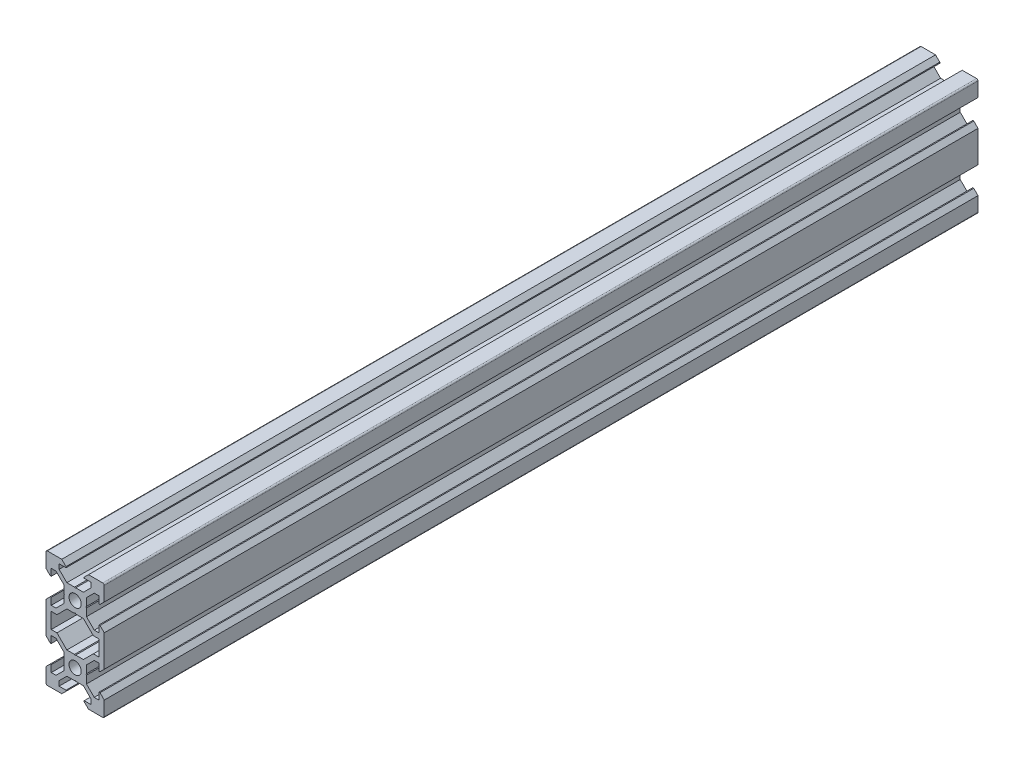
from build123d import *

# Parameters (mm, degrees)
BOSS_EXTRU_1_DEPTH  = 300
SYM_TRIE6_OUTLINE_R = 2.1
SYM_TRIE6_DEPTH     = 300


# Read off the part's stored shape, not the designer's step: Symétrie6
with BuildPart() as part:
    # Esquisse1 → Boss.-Extru.1 (new body)
    with BuildSketch(Plane.XY):
        with BuildLine():
            Line((-9.5, 10), (-4.58, 10))
            Line((-4.58, 10), (-3.125, 8.545))
            Line((-3.125, 8.545), (-3.125, 8.2))
            Line((-3.125, 8.2), (-5.5, 8.2))
            Line((-5.5, 8.2), (-5.5, 6.560660172))
            Line((-5.5, 6.560660172), (-2.839339828, 3.9))
            Line((-2.839339828, 3.9), (-0.21, 3.9))
            Line((-0.21, 3.9), (0, 3.69))
            Line((0, 3.69), (0, 2.1))
            ThreePointArc((0, 2.1), (-2.1, 0), (0, -2.1))
            Line((0, -2.1), (0, -3.69))
            Line((0, -3.69), (-0.21, -3.9))
            Line((-0.21, -3.9), (-2.839339828, -3.9))
            Line((-2.839339828, -3.9), (-6.239339828, -7.3))
            Line((-6.239339828, -7.3), (-8.2, -7.3))
            Line((-8.2, -7.3), (-8.2, -10))
            Line((-8.2, -10), (-10, -10))
            Line((-10, -10), (-10, -4.58))
            Line((-10, -4.58), (-8.545, -3.125))
            Line((-8.545, -3.125), (-8.2, -3.125))
            Line((-8.2, -3.125), (-8.2, -5.5))
            Line((-8.2, -5.5), (-6.560660172, -5.5))
            Line((-6.560660172, -5.5), (-3.9, -2.839339828))
            Line((-3.9, -2.839339828), (-3.9, -0.21))
            Line((-3.9, -0.21), (-3.69, 0))
            Line((-3.69, 0), (-3.9, 0.21))
            Line((-3.9, 0.21), (-3.9, 2.839339828))
            Line((-3.9, 2.839339828), (-6.560660172, 5.5))
            Line((-6.560660172, 5.5), (-8.2, 5.5))
            Line((-8.2, 5.5), (-8.2, 3.125))
            Line((-8.2, 3.125), (-8.545, 3.125))
            Line((-8.545, 3.125), (-10, 4.58))
            Line((-10, 4.58), (-10, 9.5))
            ThreePointArc((-10, 9.5), (-9.853553391, 9.853553391), (-9.5, 10))
        make_face()
    boss_extru_1 = extrude(amount=BOSS_EXTRU_1_DEPTH)

    # Symétrie1: Boss.-Extru.1 across Right Plane
    add(boss_extru_1.mirror(Plane(origin=(0, 0, 0), x_dir=(0, 0, -1), z_dir=(1, 0, 0))))

    # Symétrie6 outline → Symétrie6 (add)
    with BuildSketch(Plane.XY):
        with BuildLine():
            Line((-3.9, -17.160660172), (-3.9, -19.79))
            Line((-3.9, -19.79), (-3.69, -20))
            Line((-3.69, -20), (-3.9, -20.21))
            Line((-3.9, -20.21), (-3.9, -22.839339828))
            Line((-3.9, -22.839339828), (-6.560660172, -25.5))
            Line((-6.560660172, -25.5), (-8.2, -25.5))
            Line((-8.2, -25.5), (-8.2, -23.125))
            Line((-8.2, -23.125), (-8.545, -23.125))
            Line((-8.545, -23.125), (-10, -24.58))
            Line((-10, -24.58), (-10, -29.5))
            ThreePointArc((-10, -29.5), (-9.853553391, -29.853553391), (-9.5, -30))
            Line((-9.5, -30), (-4.58, -30))
            Line((-4.58, -30), (-3.125, -28.545))
            Line((-3.125, -28.545), (-3.125, -28.2))
            Line((-3.125, -28.2), (-5.5, -28.2))
            Line((-5.5, -28.2), (-5.5, -26.560660172))
            Line((-5.5, -26.560660172), (-2.839339828, -23.9))
            Line((-2.839339828, -23.9), (-0.21, -23.9))
            Line((-0.21, -23.9), (0, -23.69))
            Line((0, -23.69), (0.21, -23.9))
            Line((0.21, -23.9), (2.839339828, -23.9))
            Line((2.839339828, -23.9), (5.5, -26.560660172))
            Line((5.5, -26.560660172), (5.5, -28.2))
            Line((5.5, -28.2), (3.125, -28.2))
            Line((3.125, -28.2), (3.125, -28.545))
            Line((3.125, -28.545), (4.58, -30))
            Line((4.58, -30), (9.5, -30))
            ThreePointArc((9.5, -30), (9.853553391, -29.853553391), (10, -29.5))
            Line((10, -29.5), (10, -24.58))
            Line((10, -24.58), (8.545, -23.125))
            Line((8.545, -23.125), (8.2, -23.125))
            Line((8.2, -23.125), (8.2, -25.5))
            Line((8.2, -25.5), (6.560660172, -25.5))
            Line((6.560660172, -25.5), (3.9, -22.839339828))
            Line((3.9, -22.839339828), (3.9, -20.21))
            Line((3.9, -20.21), (3.69, -20))
            Line((3.69, -20), (3.9, -19.79))
            Line((3.9, -19.79), (3.9, -17.160660172))
            Line((3.9, -17.160660172), (6.560660172, -14.5))
            Line((6.560660172, -14.5), (8.2, -14.5))
            Line((8.2, -14.5), (8.2, -16.875))
            Line((8.2, -16.875), (8.545, -16.875))
            Line((8.545, -16.875), (10, -15.42))
            Line((10, -15.42), (10, -10))
            Line((10, -10), (8.2, -10))
            Line((8.2, -10), (8.2, -12.7))
            Line((8.2, -12.7), (6.239339828, -12.7))
            Line((6.239339828, -12.7), (2.839339828, -16.1))
            Line((2.839339828, -16.1), (0.21, -16.1))
            Line((0.21, -16.1), (0, -16.31))
            Line((0, -16.31), (-0.21, -16.1))
            Line((-0.21, -16.1), (-2.839339828, -16.1))
            Line((-2.839339828, -16.1), (-6.239339828, -12.7))
            Line((-6.239339828, -12.7), (-8.2, -12.7))
            Line((-8.2, -12.7), (-8.2, -10))
            Line((-8.2, -10), (-10, -10))
            Line((-10, -10), (-10, -15.42))
            Line((-10, -15.42), (-8.545, -16.875))
            Line((-8.545, -16.875), (-8.2, -16.875))
            Line((-8.2, -16.875), (-8.2, -14.5))
            Line((-8.2, -14.5), (-6.560660172, -14.5))
            Line((-6.560660172, -14.5), (-3.9, -17.160660172))
        make_face()
        with Locations((0, -20)):
            Circle(SYM_TRIE6_OUTLINE_R, mode=Mode.SUBTRACT)
    extrude(amount=SYM_TRIE6_DEPTH)


solid = part.part
